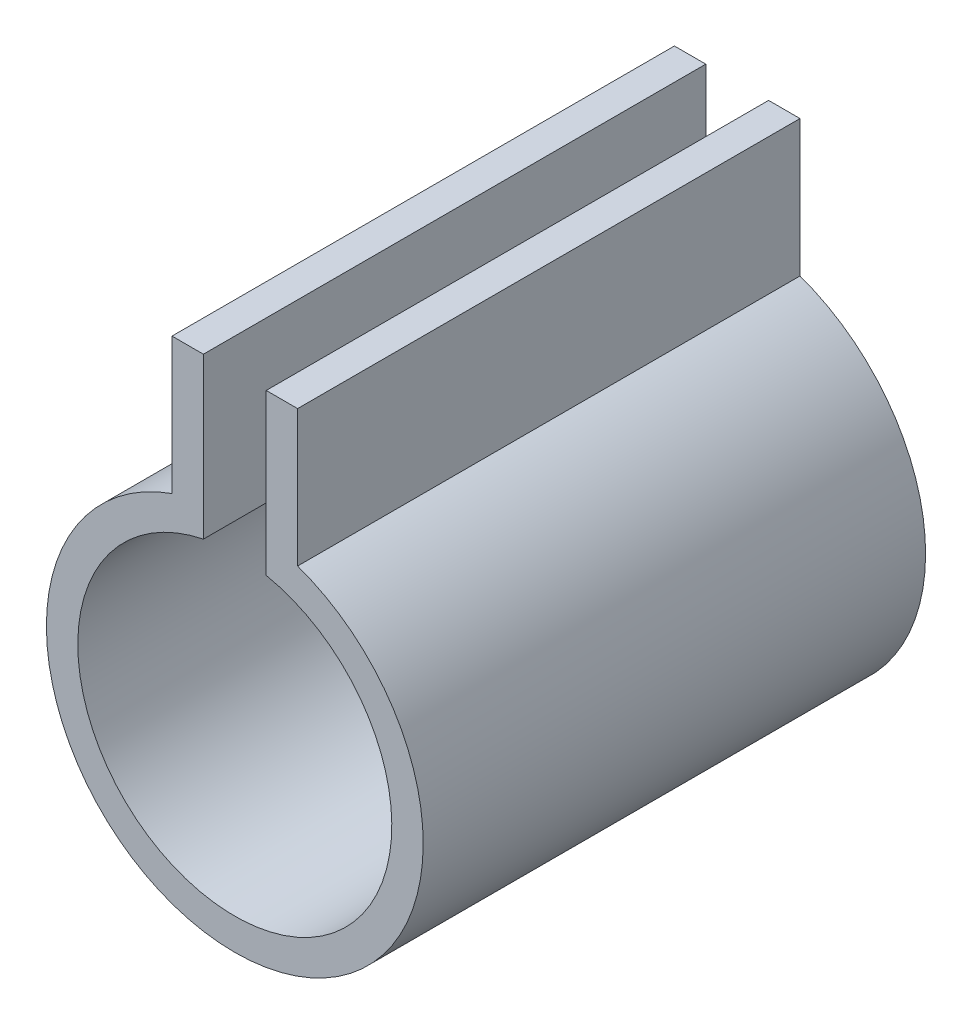
from build123d import *

# Parameters (mm, degrees)
BOSS_EXTRUDE1_DEPTH = 50.8


with BuildPart() as part:
    # Sketch2 → Boss-Extrude1 (new body)
    with BuildSketch(Plane.XY):
        with BuildLine():
            Line((3.175, 22.86), (3.175, 31.75))
            Line((3.175, 31.75), (6.35, 31.75))
            Line((6.35, 31.75), (6.35, 17.960512242))
            ThreePointArc((6.35, 17.960512242), (0, -19.05), (-6.35, 17.960512242))
            Line((-6.35, 17.960512242), (-6.35, 31.75))
            Line((-6.35, 31.75), (-3.175, 31.75))
            Line((-3.175, 31.75), (-3.175, 22.86))
            Line((-3.175, 22.86), (-3.175, 15.554259867))
            ThreePointArc((-3.175, 15.554259867), (0, -15.875), (3.175, 15.554259867))
            Line((3.175, 15.554259867), (3.175, 22.86))
        make_face()
    extrude(amount=BOSS_EXTRUDE1_DEPTH)


solid = part.part
